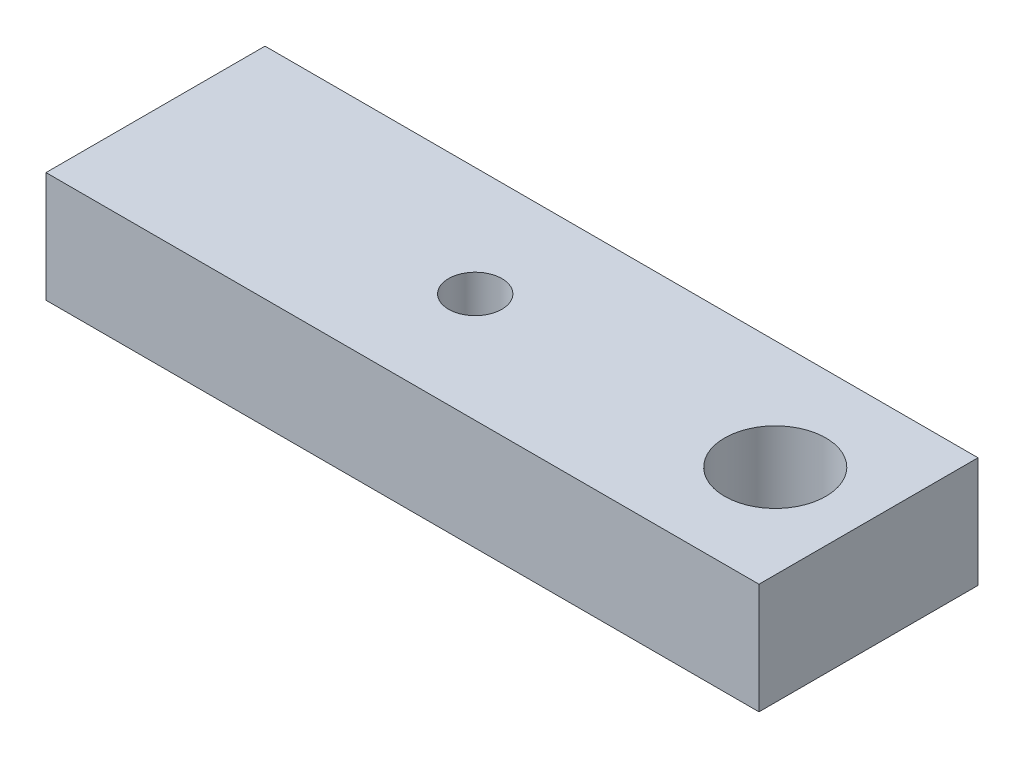
from build123d import *

# Parameters (mm, degrees)
SKETCH1_W           = 33.9852
SKETCH1_H           = 10.4394
BOSS_EXTRUDE1_DEPTH = 5.2705
SKETCH2_R           = 2.413
SKETCH2_R_2         = 1.27
CUT_EXTRUDE1_DEPTH  = 36.940966343


with BuildPart() as part:
    # Sketch1 → Boss-Extrude1 (new body)
    with BuildSketch(Plane(origin=(0, 0, 0), x_dir=(1, 0, 0), z_dir=(0, 1, 0))):
        with Locations((16.9926, 5.2197)):
            Rectangle(SKETCH1_W, SKETCH1_H)
    extrude(amount=BOSS_EXTRUDE1_DEPTH)

    # Sketch2 → Cut-Extrude1 (cut, through all)
    with BuildSketch(Plane(origin=(0, 5.2705, 0), x_dir=(1, 0, 0), z_dir=(0, 1, 0))):
        with Locations((29.5402, 5.2197)):
            Circle(SKETCH2_R)
        with Locations((15.24, 5.2197)):
            Circle(SKETCH2_R_2)
    extrude(amount=-CUT_EXTRUDE1_DEPTH, mode=Mode.SUBTRACT)


solid = part.part
